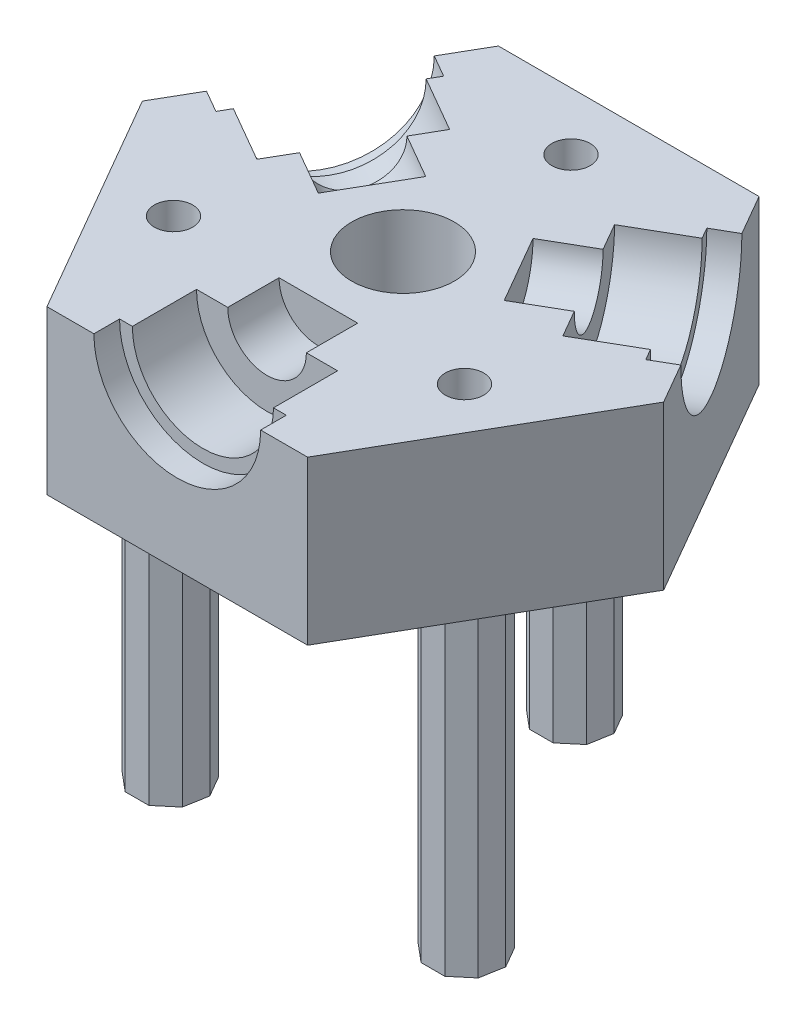
from build123d import *

# Parameters (mm, degrees)
BOSS_EXTRUDE1_DEPTH = 12.7
SKETCH2_R           = 5.5
SKETCH2_R_2         = 4.1
BOSS_EXTRUDE2_DEPTH = 3.499999906
CIRPATTERN1_COUNT   = 3
SKETCH6_R           = 4
CUT_EXTRUDE1_DEPTH  = 32.385015484
BOSS_EXTRUDE3_DEPTH = 25.4
RANDOM_CIRCLES_R    = 1.5
CUT_EXTRUDE2_DEPTH  = 2.54


with BuildPart() as part:
    # Sketch1 → Boss-Extrude1 (new body)
    with BuildSketch(Plane(origin=(0, 0, 0), x_dir=(1, 0, 0), z_dir=(0, 1, 0))):
        Polygon((10.16, -17.597636205), (20.32, 0), (10.16, 17.597636205), (-10.16, 17.597636205), (-20.32, 0), (-10.16, -17.597636205), align=None)
    extrude(amount=BOSS_EXTRUDE1_DEPTH)

    # Sketch2 → Boss-Extrude2 (add)
    with BuildSketch(Plane.XZ):
        Circle(SKETCH2_R)
        Circle(SKETCH2_R_2, mode=Mode.SUBTRACT)
    extrude(amount=BOSS_EXTRUDE2_DEPTH)

    # Sketch5 → Cut-Revolve1 (revolve, cut)
    with BuildSketch(Plane(origin=(0, 12.7, 0), x_dir=(1, 0, 0), z_dir=(0, 1, 0))):
        Polygon((0, -17.597636205), (0, -6.597636205), (-3.065310501, -6.597636205), (-3.065310501, -10.597636205), (-5.5, -10.597636205), (-5.5, -15.597636205), (-6.5, -15.597636205), (-6.5, -17.597636205), align=None)
    cut_revolve1 = revolve(axis=Axis((0, 12.7, 17.597636205), (0, 0, -1)), mode=Mode.SUBTRACT)

    # CirPattern1: Cut-Revolve1 ×3 about axis
    cirpattern1_axis = Axis((0, -3.499999906, 0), (0, 1, 0))
    for i in range(1, CIRPATTERN1_COUNT):
        add(cut_revolve1.rotate(cirpattern1_axis, i * 360 / CIRPATTERN1_COUNT), mode=Mode.SUBTRACT)

    # Sketch6 → Cut-Extrude1 (cut, through all)
    with BuildSketch(Plane(origin=(0, 12.7, 0), x_dir=(1, 0, 0), z_dir=(0, 1, 0))):
        Circle(SKETCH6_R)
    extrude(amount=-CUT_EXTRUDE1_DEPTH, mode=Mode.SUBTRACT)

    # Sketch8 → Boss-Extrude3 (add)
    with BuildSketch(Plane(origin=(0, 0, 0), x_dir=(1, 0, 0), z_dir=(0, 1, 0))):
        Polygon((-1.737462328, 15.3916171), (-2.661946723, 13.790363157), (-2.340876662, 11.969484358), (-0.924484395, 10.780990129), (0.924484395, 10.780990129), (2.340876662, 11.969484358), (2.661946723, 13.790363157), (1.737462328, 15.3916171), (0, 16.024001671), align=None)
        Polygon((14.198262578, -6.191122036), (13.273778183, -4.589868093), (11.536315855, -3.957483522), (9.798853527, -4.589868093), (8.874369132, -6.191122036), (9.195439193, -8.012000835), (10.61183146, -9.200495064), (12.46080025, -9.200495064), (13.877192517, -8.012000835), align=None)
        Polygon((-12.46080025, -9.200495064), (-10.61183146, -9.200495064), (-9.195439193, -8.012000835), (-8.874369132, -6.191122036), (-9.798853527, -4.589868093), (-11.536315855, -3.957483522), (-13.273778183, -4.589868093), (-14.198262578, -6.191122036), (-13.877192517, -8.012000835), align=None)
    extrude(amount=-BOSS_EXTRUDE3_DEPTH)

    # Random Circles → Cut-Extrude2 (cut)
    with BuildSketch(Plane(origin=(0, 12.7, 0), x_dir=(1, 0, 0), z_dir=(0, 1, 0))):
        with Locations((0, 13.097636205)):
            Circle(RANDOM_CIRCLES_R)
        with Locations((11.342882219, -6.548824102)):
            Circle(RANDOM_CIRCLES_R)
        with Locations((-11.342892611, -6.548818102)):
            Circle(RANDOM_CIRCLES_R)
    extrude(amount=-CUT_EXTRUDE2_DEPTH, mode=Mode.SUBTRACT)


solid = part.part
